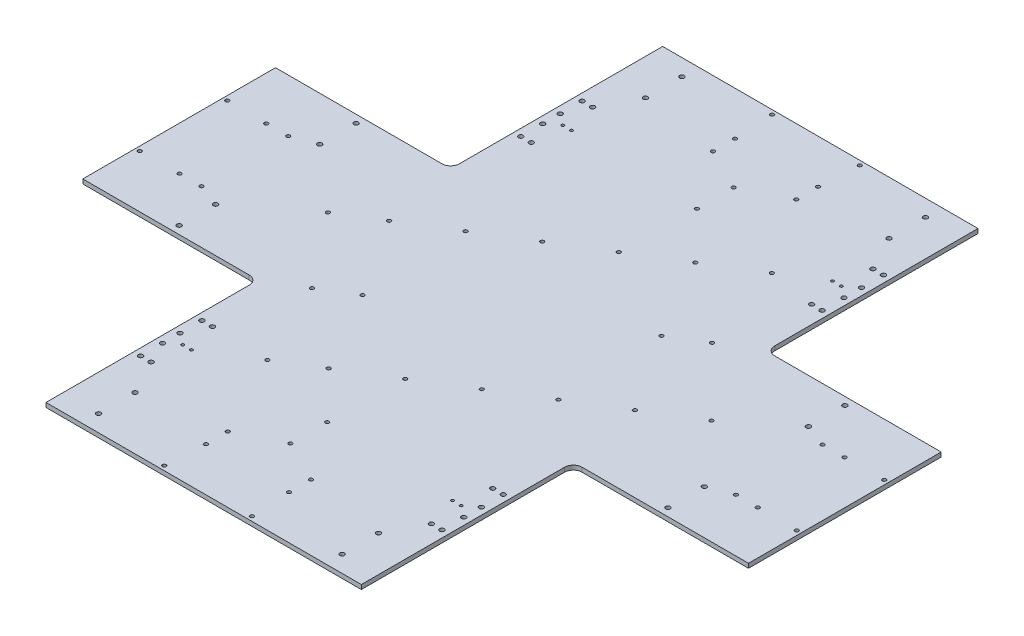
from build123d import *

# Parameters (mm, degrees)
BOSS_EXTRUDE1_DEPTH = 5
SKETCH2_R           = 2.125
CUT_EXTRUDE1_DEPTH  = 3
SKETCH4_R           = 2.6
SKETCH4_R_2         = 1.6
CUT_EXTRUDE3_DEPTH  = 10
SKETCH5_R           = 2.125
CUT_EXTRUDE4_DEPTH  = 10
FILLET1_R           = 10
SKETCH6_R           = 2.6
CUT_EXTRUDE5_DEPTH  = 10
SKETCH7_R           = 2.125
CUT_EXTRUDE6_DEPTH  = 10
SKETCH8_R           = 2.1
CUT_EXTRUDE7_DEPTH  = 10


with BuildPart() as part:
    # Sketch1 → Boss-Extrude1 (new body)
    with BuildSketch(Plane(origin=(0, 0, 0), x_dir=(1, 0, 0), z_dir=(0, 1, 0))):
        Polygon((180, 352), (-180, 352), (-180, 110), (-380, 110), (-380, -110), (-180, -110), (-180, -352), (180, -352), (180, -110), (380, -110), (380, 110), (180, 110), align=None)
    extrude(amount=BOSS_EXTRUDE1_DEPTH)

    # Sketch2 → Cut-Extrude1 (cut)
    with BuildSketch(Plane(origin=(0, 5, 0), x_dir=(1, 0, 0), z_dir=(0, 1, 0))):
        with Locations((330, 49.5)):
            Circle(SKETCH2_R)
        with Locations((305, 49.5)):
            Circle(SKETCH2_R)
        with Locations((305, -49.5)):
            Circle(SKETCH2_R)
        with Locations((330, -49.5)):
            Circle(SKETCH2_R)
        with Locations((-330, -49.5)):
            Circle(SKETCH2_R)
        with Locations((-305, -49.5)):
            Circle(SKETCH2_R)
        with Locations((-305, 49.5)):
            Circle(SKETCH2_R)
        with Locations((-330, 49.5)):
            Circle(SKETCH2_R)
        with Locations((47.5, 302)):
            Circle(SKETCH2_R)
        with Locations((47.5, 277)):
            Circle(SKETCH2_R)
        with Locations((-47.5, 277)):
            Circle(SKETCH2_R)
        with Locations((-47.5, 302)):
            Circle(SKETCH2_R)
        with Locations((-47.5, -302)):
            Circle(SKETCH2_R)
        with Locations((-47.5, -277)):
            Circle(SKETCH2_R)
        with Locations((47.5, -277)):
            Circle(SKETCH2_R)
        with Locations((47.5, -302)):
            Circle(SKETCH2_R)
    extrude(amount=-CUT_EXTRUDE1_DEPTH, mode=Mode.SUBTRACT)

    # Sketch4 → Cut-Extrude3 (cut)
    with BuildSketch(Plane(origin=(0, 5, 0), x_dir=(1, 0, 0), z_dir=(0, 1, 0))):
        with Locations((-172, 182)):
            Circle(SKETCH4_R)
        with Locations((-160, 182)):
            Circle(SKETCH4_R)
        with Locations((-172, 207)):
            Circle(SKETCH4_R)
        with Locations((-172, 227)):
            Circle(SKETCH4_R)
        with Locations((-172, 252)):
            Circle(SKETCH4_R)
        with Locations((-160, 252)):
            Circle(SKETCH4_R)
        with Locations((160, 252)):
            Circle(SKETCH4_R)
        with Locations((172, 252)):
            Circle(SKETCH4_R)
        with Locations((172, 227)):
            Circle(SKETCH4_R)
        with Locations((172, 207)):
            Circle(SKETCH4_R)
        with Locations((160, 182)):
            Circle(SKETCH4_R)
        with Locations((172, 182)):
            Circle(SKETCH4_R)
        with Locations((172, -182)):
            Circle(SKETCH4_R)
        with Locations((160, -182)):
            Circle(SKETCH4_R)
        with Locations((172, -207)):
            Circle(SKETCH4_R)
        with Locations((172, -227)):
            Circle(SKETCH4_R)
        with Locations((172, -252)):
            Circle(SKETCH4_R)
        with Locations((160, -252)):
            Circle(SKETCH4_R)
        with Locations((-160, -252)):
            Circle(SKETCH4_R)
        with Locations((-172, -252)):
            Circle(SKETCH4_R)
        with Locations((-172, -227)):
            Circle(SKETCH4_R)
        with Locations((-172, -207)):
            Circle(SKETCH4_R)
        with Locations((-160, -182)):
            Circle(SKETCH4_R)
        with Locations((-172, -182)):
            Circle(SKETCH4_R)
        with Locations((159, -217)):
            Circle(SKETCH4_R_2)
        with Locations((-159, -217)):
            Circle(SKETCH4_R_2)
        with Locations((159, 217)):
            Circle(SKETCH4_R_2)
        with Locations((-159, 217)):
            Circle(SKETCH4_R_2)
        with Locations((149, -217)):
            Circle(SKETCH4_R_2)
        with Locations((-149, -217)):
            Circle(SKETCH4_R_2)
        with Locations((149, 217)):
            Circle(SKETCH4_R_2)
        with Locations((-149, 217)):
            Circle(SKETCH4_R_2)
    extrude(amount=-CUT_EXTRUDE3_DEPTH, mode=Mode.SUBTRACT)

    # Sketch5 → Cut-Extrude4 (cut)
    with BuildSketch(Plane(origin=(0, 5, 0), x_dir=(1, 0, 0), z_dir=(0, 1, 0))):
        with Locations((-50, 347)):
            Circle(SKETCH5_R)
        with Locations((50, 347)):
            Circle(SKETCH5_R)
        with Locations((50, -347)):
            Circle(SKETCH5_R)
        with Locations((-50, -347)):
            Circle(SKETCH5_R)
        with Locations((-375, 50)):
            Circle(SKETCH5_R)
        with Locations((-375, -50)):
            Circle(SKETCH5_R)
        with Locations((375, -50)):
            Circle(SKETCH5_R)
        with Locations((375, 50)):
            Circle(SKETCH5_R)
    extrude(amount=-CUT_EXTRUDE4_DEPTH, mode=Mode.SUBTRACT)

    # Fillet1
    fillet1_edges = [part.edges().sort_by_distance(p)[0] for p in [
        (-180, 2.5, -110),
        (-180, 2.5, 110),
        (180, 2.5, 110),
        (180, 2.5, -110),
    ]]
    fillet(fillet1_edges, radius=FILLET1_R)

    # Sketch6 → Cut-Extrude5 (cut)
    with BuildSketch(Plane(origin=(0, 5, 0), x_dir=(1, 0, 0), z_dir=(0, 1, 0))):
        with Locations((139, 333)):
            Circle(SKETCH6_R)
        with Locations((139, 291.4)):
            Circle(SKETCH6_R)
        with Locations((139, -291.4)):
            Circle(SKETCH6_R)
        with Locations((139, -333)):
            Circle(SKETCH6_R)
        with Locations((-139, -333)):
            Circle(SKETCH6_R)
        with Locations((-139, -291.4)):
            Circle(SKETCH6_R)
        with Locations((-139, 291.4)):
            Circle(SKETCH6_R)
        with Locations((-139, 333)):
            Circle(SKETCH6_R)
        with Locations((279, 101)):
            Circle(SKETCH6_R)
        with Locations((279, 59.4)):
            Circle(SKETCH6_R)
        with Locations((279, -59.4)):
            Circle(SKETCH6_R)
        with Locations((279, -101)):
            Circle(SKETCH6_R)
        with Locations((-279, -101)):
            Circle(SKETCH6_R)
        with Locations((-279, -59.4)):
            Circle(SKETCH6_R)
        with Locations((-279, 59.4)):
            Circle(SKETCH6_R)
        with Locations((-279, 101)):
            Circle(SKETCH6_R)
    extrude(amount=-CUT_EXTRUDE5_DEPTH, mode=Mode.SUBTRACT)

    # Sketch7 → Cut-Extrude6 (cut)
    with BuildSketch(Plane(origin=(0, 5, 0), x_dir=(1, 0, 0), z_dir=(0, 1, 0))):
        with Locations((-55.682048102, 90.197059371)):
            Circle(SKETCH7_R)
        with Locations((-1.648904044, 123.553757998)):
            Circle(SKETCH7_R)
        with Locations((52.384240013, 156.910456625)):
            Circle(SKETCH7_R)
        with Locations((106.41738407, 190.267155252)):
            Circle(SKETCH7_R)
        with Locations((-109.715192159, 56.840360744)):
            Circle(SKETCH7_R)
        with Locations((-163.748336216, 23.483662117)):
            Circle(SKETCH7_R)
        with Locations((-206.974851462, -3.201696784)):
            Circle(SKETCH7_R)
        with Locations((-95.610755259, -183.595815527)):
            Circle(SKETCH7_R)
        with Locations((-52.384240013, -156.910456625)):
            Circle(SKETCH7_R)
        with Locations((1.648904044, -123.553757998)):
            Circle(SKETCH7_R)
        with Locations((217.781480273, 9.87303651)):
            Circle(SKETCH7_R)
        with Locations((163.748336216, -23.483662117)):
            Circle(SKETCH7_R)
        with Locations((109.715192159, -56.840360744)):
            Circle(SKETCH7_R)
        with Locations((55.682048102, -90.197059371)):
            Circle(SKETCH7_R)
    extrude(amount=-CUT_EXTRUDE6_DEPTH, mode=Mode.SUBTRACT)

    # Sketch8 → Cut-Extrude7 (cut)
    with BuildSketch(Plane(origin=(0, 5, 0), x_dir=(1, 0, 0), z_dir=(0, 1, 0))):
        with Locations((-141.23406512, -87.1891175)):
            Circle(SKETCH8_R)
        with Locations((-105.495607634, -65.126419195)):
            Circle(SKETCH8_R)
        with Locations((105.495607634, 65.126419195)):
            Circle(SKETCH8_R)
        with Locations((141.23406512, 87.1891175)):
            Circle(SKETCH8_R)
        with Locations((0, 253)):
            Circle(SKETCH8_R)
        with Locations((0, 211)):
            Circle(SKETCH8_R)
        with Locations((0, -211)):
            Circle(SKETCH8_R)
        with Locations((0, -253)):
            Circle(SKETCH8_R)
    extrude(amount=-CUT_EXTRUDE7_DEPTH, mode=Mode.SUBTRACT)


solid = part.part
